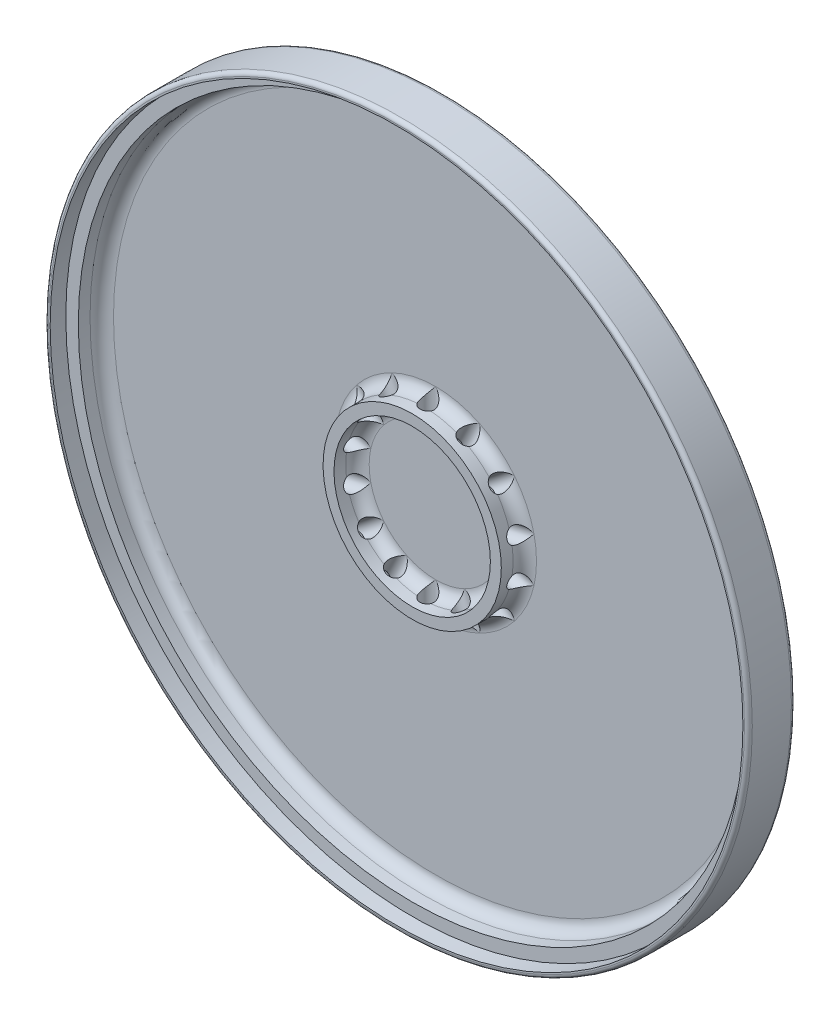
from build123d import *

# Parameters (mm, degrees)
SKETCH1_R                      = 90
SKETCH1_R_2                    = 88.6
SKETCH1_R_3                    = 85.4
SKETCH1_R_4                    = 22.8
SKETCH1_R_5                    = 20
BOSS_EXTRUDE1_DEPTH            = 2
BOSS_EXTRUDE2_START            = 10
SKETCH1_3_R                    = 90
SKETCH1_3_R_2                  = 88.6
BOSS_EXTRUDE2_DEPTH            = 10
BOSS_EXTRUDE3_START            = 6
SKETCH1_4_R                    = 88.6
SKETCH1_4_R_2                  = 85.4
BOSS_EXTRUDE3_DEPTH            = 6
SKETCH1_5_R                    = 22.8
SKETCH1_5_R_2                  = 20
BOSS_EXTRUDE4_DEPTH            = 6
CUT_EXTRUDE3_REACH             = 129.671
SKETCH2_R                      = 2
CUT_EXTRUDE3_DIRECTION_2_REACH = 129.671
FILLET1_R                      = 3
FILLET2_R                      = 3
FILLET3_R                      = 1
FILLET4_R                      = 1
CIRPATTERN1_COUNT              = 7


with BuildPart() as part:
    # Sketch1 → Boss-Extrude1 (new body)
    # profile 1 of 5: a face of its own
    with BuildSketch(Plane.XY):
        Circle(SKETCH1_R)
        Circle(SKETCH1_R_2, mode=Mode.SUBTRACT)
    # profile 2 of 5: a face of its own
    with BuildSketch(Plane.XY):
        Circle(SKETCH1_R_2)
        Circle(SKETCH1_R_3, mode=Mode.SUBTRACT)
    # profile 3 of 5: a face of its own
    with BuildSketch(Plane.XY):
        Circle(SKETCH1_R_3)
        Circle(SKETCH1_R_4, mode=Mode.SUBTRACT)
    # profile 4 of 5: a face of its own
    with BuildSketch(Plane.XY):
        Circle(SKETCH1_R_4)
        Circle(SKETCH1_R_5, mode=Mode.SUBTRACT)
    # profile 5 of 5: a face of its own
    with BuildSketch(Plane.XY):
        Circle(SKETCH1_R_5)
    extrude(amount=-BOSS_EXTRUDE1_DEPTH)

    # Sketch1<3> → Boss-Extrude2 (add)
    with BuildSketch(Plane.XY.offset(BOSS_EXTRUDE2_START)):
        Circle(SKETCH1_3_R)
        Circle(SKETCH1_3_R_2, mode=Mode.SUBTRACT)
    extrude(amount=-BOSS_EXTRUDE2_DEPTH)

    # Sketch1<4> → Boss-Extrude3 (add)
    with BuildSketch(Plane.XY.offset(BOSS_EXTRUDE3_START)):
        Circle(SKETCH1_4_R)
        Circle(SKETCH1_4_R_2, mode=Mode.SUBTRACT)
    extrude(amount=-BOSS_EXTRUDE3_DEPTH)

    # Sketch1<5> → Boss-Extrude4 (add)
    with BuildSketch(Plane.XY):
        Circle(SKETCH1_5_R)
        Circle(SKETCH1_5_R_2, mode=Mode.SUBTRACT)
    extrude(amount=BOSS_EXTRUDE4_DEPTH)

    # Sketch2 → Cut-Extrude3 (cut, up to next)
    with BuildSketch(Plane(origin=(0, 0, 0), x_dir=(1, 0, 0), z_dir=(0, 1, 0)), mode=Mode.PRIVATE) as cut_extrude3_sk1:
        with Locations(Location((0, -2, 0), (0, 0, 90))):
            Circle(SKETCH2_R)
    cut_extrude3_tool1 = extrude(cut_extrude3_sk1.sketch, amount=-CUT_EXTRUDE3_REACH, mode=Mode.PRIVATE) & part.part
    cut_extrude3 = cut_extrude3_tool1.solids().sort_by_distance((0, 0, 2))[0]
    add(cut_extrude3, mode=Mode.SUBTRACT)

    # Sketch2 → Cut-Extrude3 direction 2 (cut, up to next)
    with BuildSketch(Plane(origin=(0, 0, 0), x_dir=(1, 0, 0), z_dir=(0, 1, 0)), mode=Mode.PRIVATE) as cut_extrude3_direction_2_sk1:
        with Locations(Location((0, -2, 0), (0, 0, 90))):
            Circle(SKETCH2_R)
    cut_extrude3_direction_2_tool1 = extrude(cut_extrude3_direction_2_sk1.sketch, amount=CUT_EXTRUDE3_DIRECTION_2_REACH, mode=Mode.PRIVATE) & part.part
    cut_extrude3_direction_2 = cut_extrude3_direction_2_tool1.solids().sort_by_distance((0, 0, 2))[0]
    add(cut_extrude3_direction_2, mode=Mode.SUBTRACT)

    # Fillet1
    fillet1_edges = [part.edges().sort_by_distance(p)[0] for p in [
        (-85.4, 0, 0),
    ]]
    fillet(fillet1_edges, radius=FILLET1_R)

    # Fillet2
    # the kernel refuses this fillet: 3 mm, written as the material it adds along each edge
    with BuildSketch(Plane(origin=(0, 0, 0), x_dir=(1, 0, 0), z_dir=(0, -1, 0))) as fillet2_piece_1_section:
        with BuildLine():
            CenterArc((20 - FILLET2_R, FILLET2_R), FILLET2_R, 270, 90)
            Line((20 - FILLET2_R, 0), (20, 0))
            Line((20, 0), (20, FILLET2_R))
        make_face()
    fillet2_piece_1 = revolve(axis=Axis((0, 0, 0), (0, 0, 1)), revolution_arc=90, mode=Mode.PRIVATE)
    fillet2_piece_1 = fillet2_piece_1 - Plane(origin=(0, 13.541108847, 2), x_dir=(0, 0, -1), z_dir=(0, -1, 0)) * Cylinder(2, 80, mode=Mode.PRIVATE)
    add(fillet2_piece_1)
    with BuildSketch(Plane(origin=(0, 0, 0), x_dir=(0, 1, 0), z_dir=(1, 0, 0))) as fillet2_piece_2_section:
        with BuildLine():
            CenterArc((22.8 + FILLET2_R, FILLET2_R), FILLET2_R, 180, 90)
            Line((22.8, FILLET2_R), (22.8, 0))
            Line((22.8, 0), (22.8 + FILLET2_R, 0))
        make_face()
    fillet2_piece_2 = revolve(axis=Axis((0, 0, 0), (0, 0, 1)), revolution_arc=180, mode=Mode.PRIVATE)
    fillet2_piece_2 = fillet2_piece_2 - Plane(origin=(0, 0, 2), x_dir=(0, 0, -1), z_dir=(0, -1, 0)) * Cylinder(2, 104, mode=Mode.PRIVATE)
    add(fillet2_piece_2)
    with BuildSketch(Plane(origin=(0, 0, 0), x_dir=(0, 1, 0), z_dir=(1, 0, 0))) as fillet2_piece_3_section:
        with BuildLine():
            CenterArc((20 - FILLET2_R, FILLET2_R), FILLET2_R, 270, 90)
            Line((20 - FILLET2_R, 0), (20, 0))
            Line((20, 0), (20, FILLET2_R))
        make_face()
    fillet2_piece_3 = revolve(axis=Axis((0, 0, 0), (0, 0, 1)), revolution_arc=180, mode=Mode.PRIVATE)
    fillet2_piece_3 = fillet2_piece_3 - Plane(origin=(0, 0, 2), x_dir=(0, 0, -1), z_dir=(0, -1, 0)) * Cylinder(2, 80, mode=Mode.PRIVATE)
    add(fillet2_piece_3)
    with BuildSketch(Plane(origin=(0, 0, 0), x_dir=(0, -1, 0), z_dir=(-1, 0, 0))) as fillet2_piece_4_section:
        with BuildLine():
            CenterArc((22.8 + FILLET2_R, FILLET2_R), FILLET2_R, 180, 90)
            Line((22.8, FILLET2_R), (22.8, 0))
            Line((22.8, 0), (22.8 + FILLET2_R, 0))
        make_face()
    fillet2_piece_4 = revolve(axis=Axis((0, 0, 0), (0, 0, 1)), revolution_arc=90, mode=Mode.PRIVATE)
    fillet2_piece_4 = fillet2_piece_4 - Plane(origin=(0, -16.721645695, 2), x_dir=(0, 0, -1), z_dir=(0, 1, 0)) * Cylinder(2, 104, mode=Mode.PRIVATE)
    add(fillet2_piece_4)
    with BuildSketch(Plane(origin=(0, 0, 0), x_dir=(1, 0, 0), z_dir=(0, -1, 0))) as fillet2_piece_5_section:
        with BuildLine():
            CenterArc((22.8 + FILLET2_R, FILLET2_R), FILLET2_R, 180, 90)
            Line((22.8, FILLET2_R), (22.8, 0))
            Line((22.8, 0), (22.8 + FILLET2_R, 0))
        make_face()
    fillet2_piece_5 = revolve(axis=Axis((0, 0, 0), (0, 0, 1)), revolution_arc=90, mode=Mode.PRIVATE)
    fillet2_piece_5 = fillet2_piece_5 - Plane(origin=(0, 16.721645739, 2), x_dir=(0, 0, -1), z_dir=(0, -1, 0)) * Cylinder(2, 104, mode=Mode.PRIVATE)
    add(fillet2_piece_5)
    with BuildSketch(Plane(origin=(0, 0, 0), x_dir=(0, -1, 0), z_dir=(-1, 0, 0))) as fillet2_piece_6_section:
        with BuildLine():
            CenterArc((20 - FILLET2_R, FILLET2_R), FILLET2_R, 270, 90)
            Line((20 - FILLET2_R, 0), (20, 0))
            Line((20, 0), (20, FILLET2_R))
        make_face()
    fillet2_piece_6 = revolve(axis=Axis((0, 0, 0), (0, 0, 1)), revolution_arc=90, mode=Mode.PRIVATE)
    fillet2_piece_6 = fillet2_piece_6 - Plane(origin=(0, -13.541108804, 2), x_dir=(0, 0, -1), z_dir=(0, 1, 0)) * Cylinder(2, 80, mode=Mode.PRIVATE)
    add(fillet2_piece_6)

    # Fillet3
    fillet3_edges = [part.edges().sort_by_distance(p)[0] for p in [
        (-90, 0, -2),
    ]]
    fillet(fillet3_edges, radius=FILLET3_R)

    # Fillet4
    fillet4_edges = [part.edges().sort_by_distance(p)[0] for p in [
        (-90, 0, 10),
    ]]
    fillet(fillet4_edges, radius=FILLET4_R)

    # CirPattern1: Cut-Extrude3, Cut-Extrude3 direction 2; each copy of Cut-Extrude3, Cut-Extrude3 direction 2 runs up to whatever stops it at its own place
    cirpattern1_before = part.part  # the part as the pattern finds it: every copy runs up to it
    cirpattern1_cut_extrude3_long = extrude(cut_extrude3_sk1.sketch, amount=-CUT_EXTRUDE3_REACH, mode=Mode.PRIVATE)
    cirpattern1_cut_extrude3_tool1 = cirpattern1_cut_extrude3_long.rotate(Axis((0, 0, 6), (0, 0, -1)), 1 * 360 / CIRPATTERN1_COUNT) & cirpattern1_before
    add(cirpattern1_cut_extrude3_tool1.solids().sort_by_distance((0, 0, 2))[0], mode=Mode.SUBTRACT)
    cirpattern1_cut_extrude3_tool2 = cirpattern1_cut_extrude3_long.rotate(Axis((0, 0, 6), (0, 0, -1)), 2 * 360 / CIRPATTERN1_COUNT) & cirpattern1_before
    add(cirpattern1_cut_extrude3_tool2.solids().sort_by_distance((0, 0, 2))[0], mode=Mode.SUBTRACT)
    cirpattern1_cut_extrude3_tool3 = cirpattern1_cut_extrude3_long.rotate(Axis((0, 0, 6), (0, 0, -1)), 3 * 360 / CIRPATTERN1_COUNT) & cirpattern1_before
    add(cirpattern1_cut_extrude3_tool3.solids().sort_by_distance((0, 0, 2))[0], mode=Mode.SUBTRACT)
    cirpattern1_cut_extrude3_tool4 = cirpattern1_cut_extrude3_long.rotate(Axis((0, 0, 6), (0, 0, -1)), 4 * 360 / CIRPATTERN1_COUNT) & cirpattern1_before
    add(cirpattern1_cut_extrude3_tool4.solids().sort_by_distance((0, 0, 2))[0], mode=Mode.SUBTRACT)
    cirpattern1_cut_extrude3_tool5 = cirpattern1_cut_extrude3_long.rotate(Axis((0, 0, 6), (0, 0, -1)), 5 * 360 / CIRPATTERN1_COUNT) & cirpattern1_before
    add(cirpattern1_cut_extrude3_tool5.solids().sort_by_distance((0, 0, 2))[0], mode=Mode.SUBTRACT)
    cirpattern1_cut_extrude3_tool6 = cirpattern1_cut_extrude3_long.rotate(Axis((0, 0, 6), (0, 0, -1)), 6 * 360 / CIRPATTERN1_COUNT) & cirpattern1_before
    add(cirpattern1_cut_extrude3_tool6.solids().sort_by_distance((0, 0, 2))[0], mode=Mode.SUBTRACT)
    cirpattern1_cut_extrude3_direction_2_long = extrude(cut_extrude3_direction_2_sk1.sketch, amount=CUT_EXTRUDE3_DIRECTION_2_REACH, mode=Mode.PRIVATE)
    cirpattern1_cut_extrude3_direction_2_tool1 = cirpattern1_cut_extrude3_direction_2_long.rotate(Axis((0, 0, 6), (0, 0, -1)), 1 * 360 / CIRPATTERN1_COUNT) & cirpattern1_before
    add(cirpattern1_cut_extrude3_direction_2_tool1.solids().sort_by_distance((0, 0, 2))[0], mode=Mode.SUBTRACT)
    cirpattern1_cut_extrude3_direction_2_tool2 = cirpattern1_cut_extrude3_direction_2_long.rotate(Axis((0, 0, 6), (0, 0, -1)), 2 * 360 / CIRPATTERN1_COUNT) & cirpattern1_before
    add(cirpattern1_cut_extrude3_direction_2_tool2.solids().sort_by_distance((0, 0, 2))[0], mode=Mode.SUBTRACT)
    cirpattern1_cut_extrude3_direction_2_tool3 = cirpattern1_cut_extrude3_direction_2_long.rotate(Axis((0, 0, 6), (0, 0, -1)), 3 * 360 / CIRPATTERN1_COUNT) & cirpattern1_before
    add(cirpattern1_cut_extrude3_direction_2_tool3.solids().sort_by_distance((0, 0, 2))[0], mode=Mode.SUBTRACT)
    cirpattern1_cut_extrude3_direction_2_tool4 = cirpattern1_cut_extrude3_direction_2_long.rotate(Axis((0, 0, 6), (0, 0, -1)), 4 * 360 / CIRPATTERN1_COUNT) & cirpattern1_before
    add(cirpattern1_cut_extrude3_direction_2_tool4.solids().sort_by_distance((0, 0, 2))[0], mode=Mode.SUBTRACT)
    cirpattern1_cut_extrude3_direction_2_tool5 = cirpattern1_cut_extrude3_direction_2_long.rotate(Axis((0, 0, 6), (0, 0, -1)), 5 * 360 / CIRPATTERN1_COUNT) & cirpattern1_before
    add(cirpattern1_cut_extrude3_direction_2_tool5.solids().sort_by_distance((0, 0, 2))[0], mode=Mode.SUBTRACT)
    cirpattern1_cut_extrude3_direction_2_tool6 = cirpattern1_cut_extrude3_direction_2_long.rotate(Axis((0, 0, 6), (0, 0, -1)), 6 * 360 / CIRPATTERN1_COUNT) & cirpattern1_before
    add(cirpattern1_cut_extrude3_direction_2_tool6.solids().sort_by_distance((0, 0, 2))[0], mode=Mode.SUBTRACT)


solid = part.part
